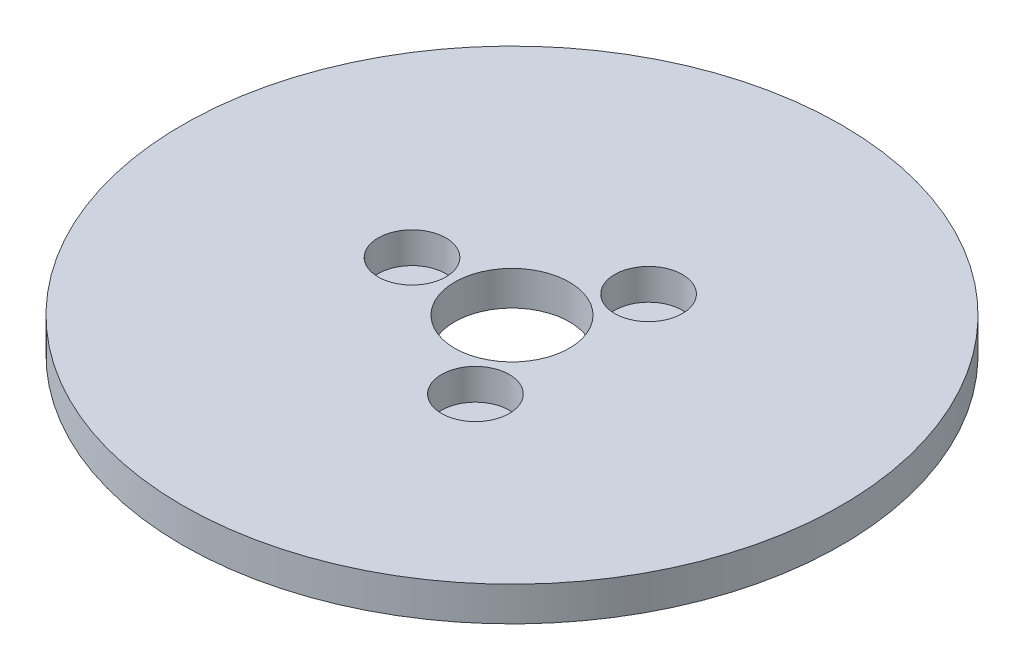
from build123d import *

# Parameters (mm, degrees)
SKETCH1_R           = 57.5
BOSS_EXTRUDE1_DEPTH = 6
SKETCH2_R           = 10
CUT_EXTRUDE1_DEPTH  = 82.538334543
SKETCH3_R           = 5.907043195
CUT_EXTRUDE2_DEPTH  = 5.410787294
CIRPATTERN1_COUNT   = 3


with BuildPart() as part:
    # Sketch1 → Boss-Extrude1 (new body)
    with BuildSketch(Plane(origin=(0, 0, 0), x_dir=(1, 0, 0), z_dir=(0, 1, 0))):
        Circle(SKETCH1_R)
    extrude(amount=BOSS_EXTRUDE1_DEPTH)

    # Sketch2 → Cut-Extrude1 (cut, through all)
    with BuildSketch(Plane(origin=(0, 0, 0), x_dir=(1, 0, 0), z_dir=(0, 1, 0))):
        Circle(SKETCH2_R)
    extrude(amount=CUT_EXTRUDE1_DEPTH, mode=Mode.SUBTRACT)

    # Sketch3 → Cut-Extrude2 (cut)
    with BuildSketch(Plane(origin=(0, 6, 0), x_dir=(1, 0, 0), z_dir=(0, 1, 0))):
        with Locations((-17.443020835, 0)):
            Circle(SKETCH3_R)
    cut_extrude2 = extrude(amount=-CUT_EXTRUDE2_DEPTH, mode=Mode.SUBTRACT)

    # CirPattern1: Cut-Extrude2 ×3 about axis
    cirpattern1_axis = Axis((0, 0, 0), (0, 1, 0))
    for i in range(1, CIRPATTERN1_COUNT):
        add(cut_extrude2.rotate(cirpattern1_axis, i * 360 / CIRPATTERN1_COUNT), mode=Mode.SUBTRACT)


solid = part.part
